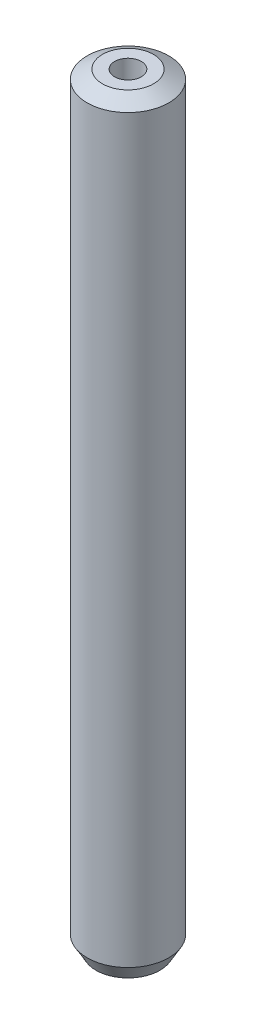
from build123d import *
from OCP.BRepFilletAPI import BRepFilletAPI_MakeChamfer

# Parameters (mm, degrees)
SKETCH1_R           = 25
BOSS_EXTRUDE1_DEPTH = 468.509761189
SKETCH2_R           = 8.183767609
CUT_EXTRUDE1_DEPTH  = 470.841884392
CHAMFER1_SIZE       = 5.404267337
CHAMFER1_SIZE2      = 9.360465606


with BuildPart() as part:
    # Sketch1 → Boss-Extrude1 (new body)
    with BuildSketch(Plane(origin=(0, 0, 0), x_dir=(1, 0, 0), z_dir=(0, 1, 0))):
        Circle(SKETCH1_R)
    extrude(amount=BOSS_EXTRUDE1_DEPTH)

    # Sketch2 → Cut-Extrude1 (cut, through all)
    with BuildSketch(Plane(origin=(0, 0, 0), x_dir=(1, 0, 0), z_dir=(0, 1, 0))):
        Circle(SKETCH2_R)
    extrude(amount=CUT_EXTRUDE1_DEPTH, mode=Mode.SUBTRACT)

    # Chamfer1: one chamfer whose edges measure the first distance from different faces: ONE call of the kernel's chamfer builder (chamfer() names one face for all edges)
    chamfer1_edges_1 = [part.edges().sort_by_distance(p)[0] for p in [
        (-25, 468.509761189, 0),
    ]]
    chamfer1_side_1 = [part.faces().sort_by_distance(p)[0] for p in [
        (-25, 234.254880594, 0),
    ]]
    chamfer1_edges_2 = [part.edges().sort_by_distance(p)[0] for p in [
        (-25, 0, 0),
    ]]
    chamfer1_side_2 = [part.faces().sort_by_distance(p)[0] for p in [
        (-24.292893219, 0, 0),
    ]]
    chamfer1 = BRepFilletAPI_MakeChamfer(part.part.solid().wrapped)
    for e in chamfer1_edges_1:
        chamfer1.Add(CHAMFER1_SIZE, CHAMFER1_SIZE2, e.wrapped, chamfer1_side_1[0].wrapped)  # the first distance lies on this face
    for e in chamfer1_edges_2:
        chamfer1.Add(CHAMFER1_SIZE, CHAMFER1_SIZE2, e.wrapped, chamfer1_side_2[0].wrapped)  # the first distance lies on this face
    add(Compound.cast(chamfer1.Shape()), mode=Mode.REPLACE)


solid = part.part
